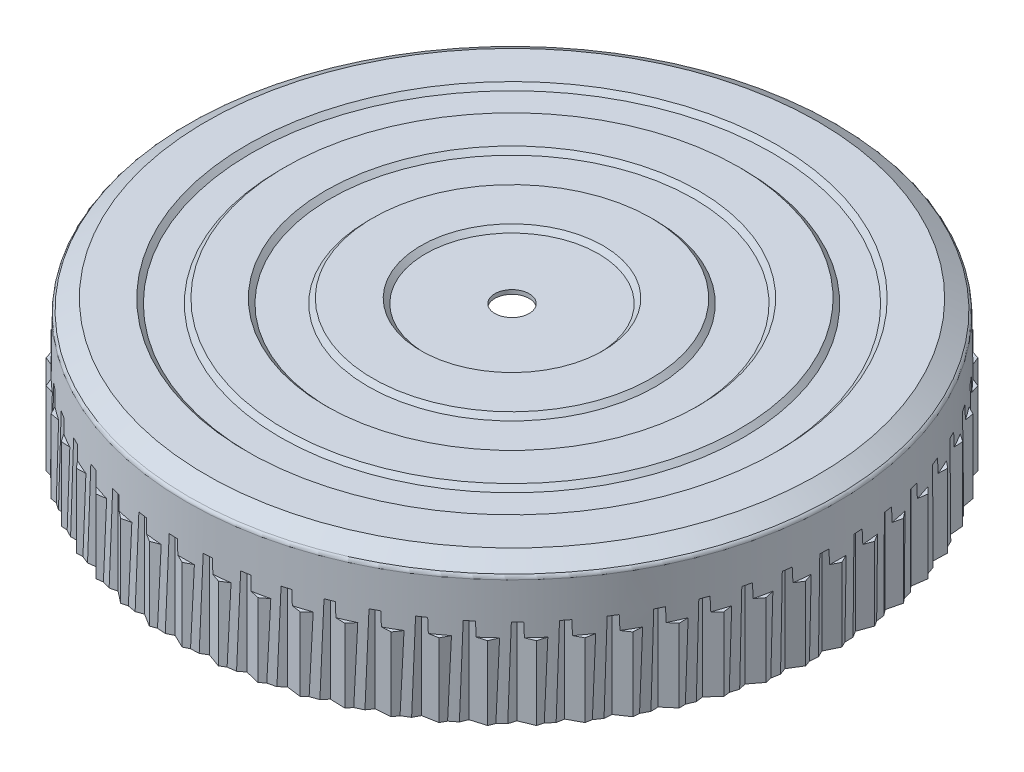
from build123d import *

# Parameters (mm, degrees)
SKETCH2_R           = 3.175
CUT_EXTRUDE1_DEPTH  = 89.909237858
FILLET1_R           = 0.79375
CUT_EXTRUDE2_DEPTH  = 17.78
BOSS_EXTRUDE1_DEPTH = 15.24
CIRPATTERN1_COUNT   = 60


with BuildPart() as part:
    # Sketch1 → Revolve1 (revolve)
    with BuildSketch(Plane.XY, mode=Mode.PRIVATE) as revolve1_sk:
        Polygon((0, 0.762), (16.002, 0.762), (16.8656, 1.6256), (25.7556, 1.6256), (26.6192, 0.762), (33.655, 0.762), (34.5186, 1.6256), (42.037, 1.6256), (42.9006, 0.762), (48.26, 0.762), (49.1236, 1.6256), (56.642, 1.6256), (60.197999997, -0.5334), (60.578999997, -23.761903156), (59.817102478, -23.774399999), (59.443000619, -0.966457133), (56.428788872, 0.8636), (49.336811128, 0.8636), (48.473211128, 0), (42.584969265, 0), (41.721369265, 0.8636), (34.834230735, 0.8636), (33.970630735, 0), (26.303569265, 0), (25.439969265, 0.8636), (17.181230735, 0.8636), (16.317630735, 0), (0, 0), align=None)
    revolve(revolve1_sk.sketch.rotate(Axis((0, 0, 0), (0, 1, 0)), 90), axis=Axis((0, 0, 0), (0, 1, 0)))

    # Sketch2 → Cut-Extrude1 (cut, through all)
    with BuildSketch(Plane(origin=(0, 0, 0), x_dir=(1, 0, 0), z_dir=(0, 1, 0))):
        with Locations(Location((0, 0, 0), (0, 0, 270))):
            Circle(SKETCH2_R)
    extrude(amount=CUT_EXTRUDE1_DEPTH, mode=Mode.SUBTRACT)

    # Fillet1
    fillet1_edges = [part.edges().sort_by_distance(p)[0] for p in [
        (0, -0.5334, 60.197999997),
        (0, -0.966457133, 59.443000619),
    ]]
    fillet(fillet1_edges, radius=FILLET1_R)

    # Sketch3 → Cut-Extrude2 (cut)
    with BuildSketch(Plane(origin=(0, -25.4, 0), x_dir=(1, 0, 0), z_dir=(0, 1, 0))):
        Polygon((59.810704542, -0.874854877), (60.238700186, 0), (59.810704542, 0.874854877), (59.015544012, 2.500222048), (59.015544012, -2.500222048), align=None)
        Polygon((60.569773522, -1.05724933), (61.087, 0), (61.087, -5.000444095), (60.569773522, -3.943194766), (59.863843827, -2.500222048), align=None)
    cut_extrude2 = extrude(amount=CUT_EXTRUDE2_DEPTH, mode=Mode.SUBTRACT)

    # Sketch4 → Boss-Extrude1 (add)
    with BuildSketch(Plane(origin=(0, -25.4, 0), x_dir=(1, 0, 0), z_dir=(0, 1, 0))):
        Polygon((59.810704542, -0.874854877), (59.015544012, -2.500222048), (59.691065436, -3.881038002), (59.863843827, -4.234209862), (59.863843827, -2.500222048), (60.569773522, -1.05724933), (61.087, 0), (60.569773522, 1.05724933), (60.238700186, 1.733987814), (60.238700186, 0), align=None)
    boss_extrude1 = extrude(amount=BOSS_EXTRUDE1_DEPTH)

    # CirPattern1: Cut-Extrude2, Boss-Extrude1 ×60 about axis
    cirpattern1_axis = Axis((0, 0, 0), (0, 1, 0))
    add([cut_extrude2.rotate(cirpattern1_axis, i * 360 / CIRPATTERN1_COUNT) for i in range(1, CIRPATTERN1_COUNT)], mode=Mode.SUBTRACT)
    add([boss_extrude1.rotate(cirpattern1_axis, i * 360 / CIRPATTERN1_COUNT) for i in range(1, CIRPATTERN1_COUNT)])

    # Sketch5 → Cut-Revolve1 (revolve, cut)
    with BuildSketch(Plane.XY, mode=Mode.PRIVATE) as cut_revolve1_sk:
        Polygon((63.5, -23.713992148), (0, -24.755535799), (0, -30.063992148), (63.5, -30.063992148), align=None)
    revolve(cut_revolve1_sk.sketch.rotate(Axis((0, -0.966457133, 0), (0, -1, 0)), 269.000000001), axis=Axis((0, -0.966457133, 0), (0, -1, 0)), mode=Mode.SUBTRACT)


solid = part.part
